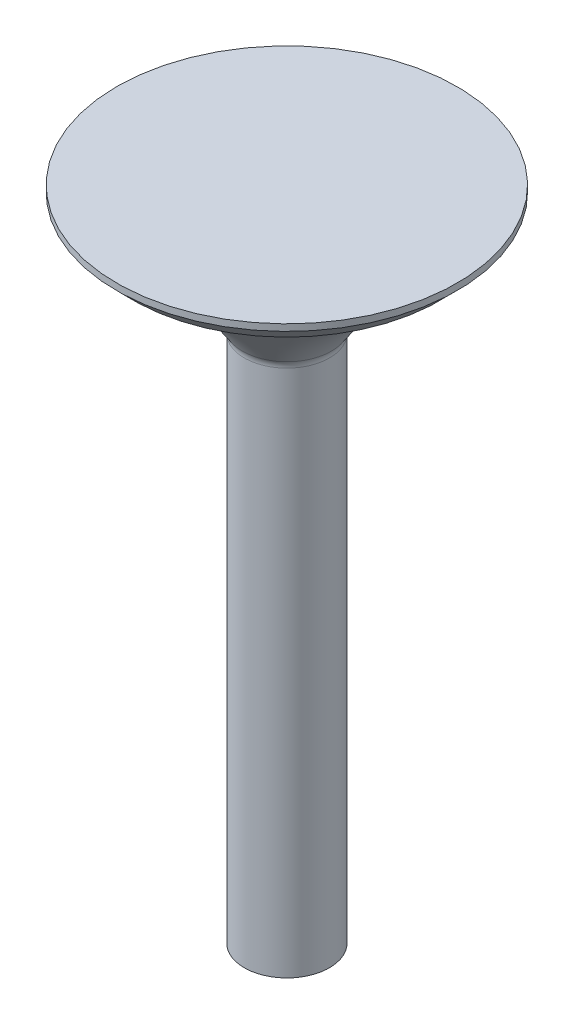
from build123d import *

# Parameters (mm, degrees)
FILLET4_R = 2


with BuildPart() as part:
    # Sketch1 → Revolve1 (revolve)
    with BuildSketch(Plane.XY):
        with BuildLine():
            Line((0, 224.082988103), (-25.92, 224.082988103))
            Line((-25.92, 224.082988103), (-25.92, 223.082988103))
            Line((-25.92, 223.082988103), (-23.328, 220.490988103))
            ThreePointArc((-23.328, 220.490988103), (-13.778107811, 214.000711488), (-6.48, 205.052988103))
            Line((-6.48, 205.052988103), (-6.48, 124.082988103))
            Line((-6.48, 124.082988103), (0, 124.082988103))
            Line((0, 124.082988103), (0, 224.082988103))
        make_face()
    revolve(axis=Axis((0, 224.082988103, 0), (0, -1, 0)))

    # Fillet4
    fillet4_edges = [part.edges().sort_by_distance(p)[0] for p in [
        (6.48, 205.052988103, 0),
    ]]
    fillet(fillet4_edges, radius=FILLET4_R)


solid = part.part
